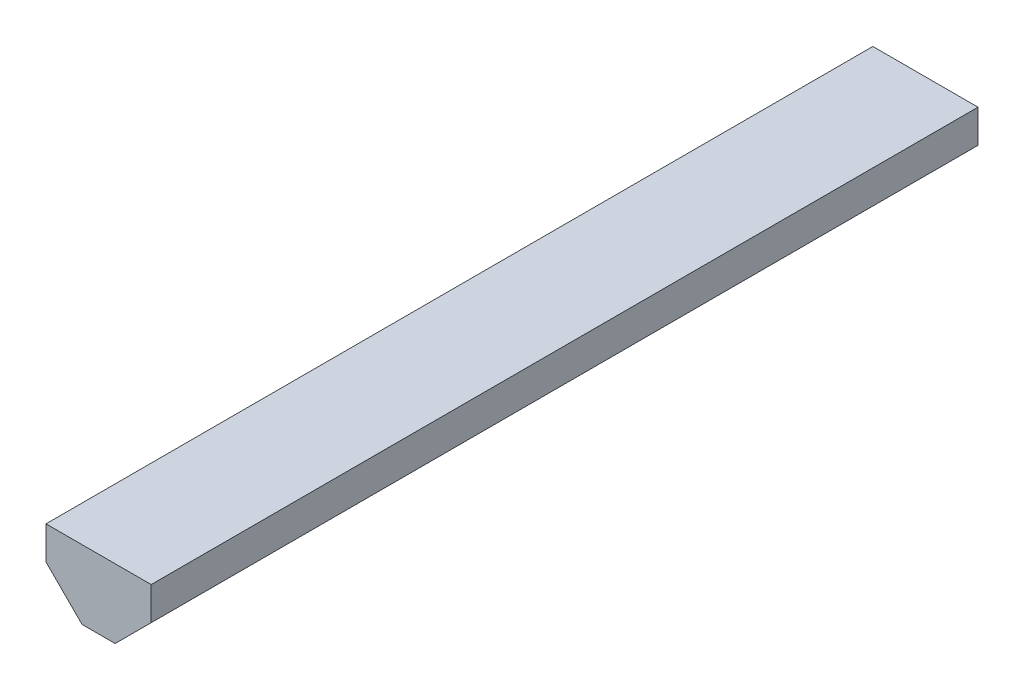
from build123d import *

# Parameters (mm, degrees)
VTAIL_EXTRUDE_DEPTH = 952.5
SKETCH3_R           = 25.962293135
CUT_EXTRUDE1_DEPTH  = 2.54
SKETCH4_R           = 25.962293135
CUT_EXTRUDE2_DEPTH  = 2.54


with BuildPart() as part:
    # vtail → vtail_extrude (new body)
    with BuildSketch(Plane.XY):
        Polygon((19.05, -60.57513929), (-19.05, -60.57513929), (-60.57513929, -19.05), (-60.57513929, 19.05), (60.57513929, 19.05), (60.57513929, -19.05), align=None)
    extrude(amount=VTAIL_EXTRUDE_DEPTH)

    # Sketch3 → Cut-Extrude1 (cut)
    with BuildSketch(Plane(origin=(39.812569645, -39.812569645, 0), x_dir=(0, 0, -1), z_dir=(0.7071067811865441, -0.7071067811865509, 0))):
        with Locations((-901.7, 0)):
            Circle(SKETCH3_R)
    extrude(amount=-CUT_EXTRUDE1_DEPTH, mode=Mode.SUBTRACT)

    # Sketch4 → Cut-Extrude2 (cut)
    with BuildSketch(Plane(origin=(-39.812569645, -39.812569645, 0), x_dir=(0, 0, 1), z_dir=(-0.7071067811865486, -0.7071067811865465, 0))):
        with Locations((901.7, 0)):
            Circle(SKETCH4_R)
    extrude(amount=-CUT_EXTRUDE2_DEPTH, mode=Mode.SUBTRACT)


solid = part.part
